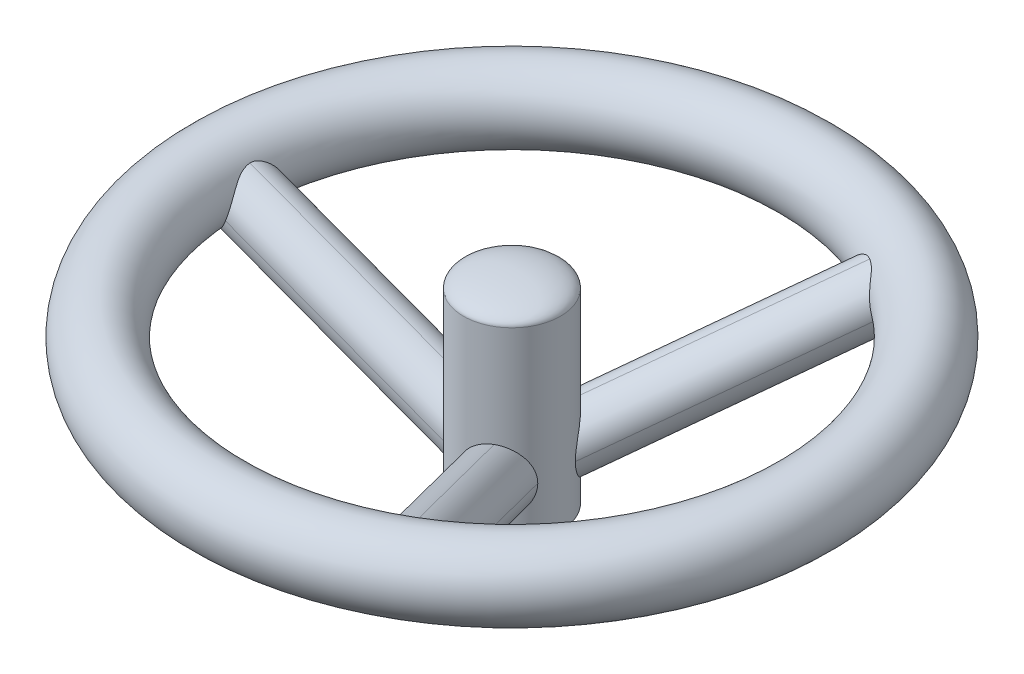
from build123d import *

# Parameters (mm, degrees)
SKETCH1_R                = 25
SKETCH1_W                = 33.127050545
SKETCH1_H                = 126.975324737
DOME1_FACE_RADIUS        = 33.127050545
DOME1_HEIGHT             = 10
BOSS_EXTRUDE1_DEPTH      = 20
BOSS_EXTRUDE1_DEPTH_BACK = 20
FILLET1_R                = 20
FILLET2_R                = 20
CIRPATTERN2_COUNT        = 3


with BuildPart() as part:
    # Sketch1 → Revolve1 (revolve)
    with BuildSketch(Plane.XY, mode=Mode.PRIVATE) as revolve1_sk:
        with Locations((200, 0)):
            Circle(SKETCH1_R)
        with Locations((16.563525273, -34.644113748)):
            Rectangle(SKETCH1_W, SKETCH1_H)
    revolve(revolve1_sk.sketch.rotate(Axis((0, -98.131776117, 0), (0, 1, 0)), 90), axis=Axis((0, -98.131776117, 0), (0, 1, 0)))

    # Dome1: an elliptical dome of height H over a round flat face of radius A is half a spheroid: the quarter ellipse of half axes A and H revolved about the face's axis
    with BuildSketch(Plane((0, 28.84354862, 0), x_dir=(0, 0, -1), z_dir=(1, 0, 0)), mode=Mode.PRIVATE) as dome1_quarter:
        Ellipse(DOME1_FACE_RADIUS, DOME1_HEIGHT)
        Rectangle(DOME1_FACE_RADIUS, DOME1_HEIGHT, align=(Align.MIN, Align.MIN), mode=Mode.INTERSECT)
    revolve(dome1_quarter.sketch, axis=Axis((0, 28.84354862, 0), (0, 1, 0)))


with BuildPart() as body_2:
    # Sketch2 → Boss-Extrude1 (new, two sides: drawn at the far end of the back side and taken through both)
    with BuildSketch(Plane.XY.offset(-BOSS_EXTRUDE1_DEPTH_BACK)):
        Polygon((-206.992781228, -18.737689578), (-32.627553009, -83.80963399), (-19.392036111, -88.749040939), (-5.406473656, -51.273661784), (-18.641990554, -46.334254835), (-193.007218772, 18.737689578), align=None)
    extrude(amount=BOSS_EXTRUDE1_DEPTH + BOSS_EXTRUDE1_DEPTH_BACK)

    # Fillet1
    fillet1_edges = [body_2.edges().sort_by_distance(p)[0] for p in [
        (-113.192408669, -53.743365258, -20),
        (-99.206846214, -16.267986103, 20),
        (-113.192408669, -53.743365258, 20),
    ]]
    fillet(fillet1_edges, radius=FILLET1_R - 0.0001)  # a hair under: the kernel refuses the full size

    # Fillet2
    fillet2_edges = [body_2.edges().sort_by_distance(p)[0] for p in [
        (-99.206846214, -16.267986103, -20),
    ]]
    fillet(fillet2_edges, radius=FILLET2_R)


with BuildPart() as cirpattern2_1:
    # CirPattern2: pattern copy
    add(body_2.part.rotate(Axis((0, 0, 0), (0, 1, 0)), 1 * 360 / CIRPATTERN2_COUNT))


with BuildPart() as cirpattern2_2:
    # CirPattern2: pattern copy
    add(body_2.part.rotate(Axis((0, 0, 0), (0, 1, 0)), 2 * 360 / CIRPATTERN2_COUNT))


solid = Compound([part.part, body_2.part, cirpattern2_1.part, cirpattern2_2.part])
